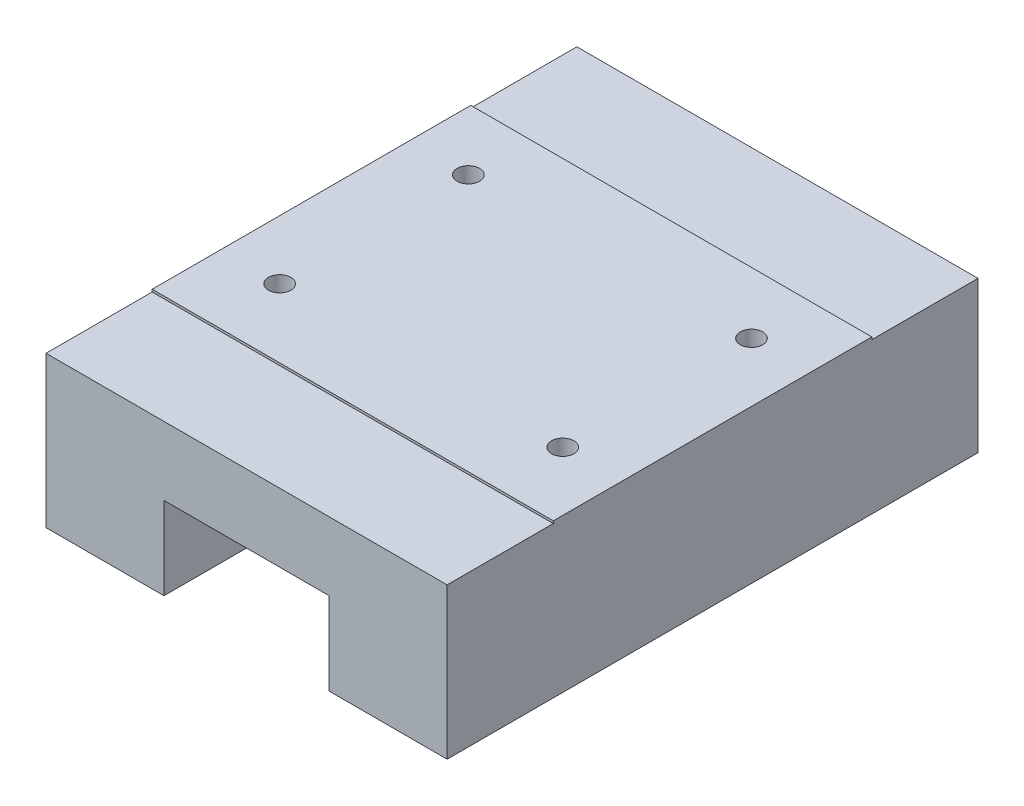
from build123d import *

# Parameters (mm, degrees)
SKETCH1_W                    = 17
SKETCH1_H                    = 6.5
BOSS_EXTRUDE1_DEPTH          = 13.5
BOSS_EXTRUDE2_DEPTH          = 4.5
BOSS_EXTRUDE2_DEPTH_BACK     = 18
SKETCH4_W                    = 17
SKETCH4_H                    = 6.4
M1_2X0_25_TAPPED_HOLE1_D     = 0.95
M1_2X0_25_TAPPED_HOLE1_DEPTH = 3.65
M1_2X0_25_TAPPED_HOLE1_TIP   = 0.285408794
SKETCH5_W                    = 7
SKETCH5_H                    = 3.5
CUT_EXTRUDE1_DEPTH           = 29.939592257


with BuildPart() as part:
    # Sketch1 → Boss-Extrude1 (new body)
    with BuildSketch(Plane.XY):
        with Locations((8.5, 3.25)):
            Rectangle(SKETCH1_W, SKETCH1_H)
    extrude(amount=BOSS_EXTRUDE1_DEPTH)

    # Sketch4 → Boss-Extrude2 (add, two sides: drawn at the far end of the back side and taken through both)
    with BuildSketch(Plane.XY.offset(13.5).offset(-BOSS_EXTRUDE2_DEPTH_BACK)):
        with Locations((8.5, 3.2)):
            Rectangle(SKETCH4_W, SKETCH4_H)
    extrude(amount=BOSS_EXTRUDE2_DEPTH + BOSS_EXTRUDE2_DEPTH_BACK)

    # M1.2x0.25 Tapped Hole1
    with Locations(Plane(origin=(0, 6.5, 0), x_dir=(1, 0, 0), z_dir=(0, 1, 0))):
        with Locations((2.5, -10.6), (14.5, -10.6), (14.5, -2.6), (2.5, -2.6)):
            Hole(M1_2X0_25_TAPPED_HOLE1_D / 2, depth=M1_2X0_25_TAPPED_HOLE1_DEPTH)
            with Locations((0, 0, -(M1_2X0_25_TAPPED_HOLE1_DEPTH + M1_2X0_25_TAPPED_HOLE1_TIP / 2))):  # 118° drill point
                Cone(0, M1_2X0_25_TAPPED_HOLE1_D / 2, M1_2X0_25_TAPPED_HOLE1_TIP, mode=Mode.SUBTRACT)

    # Sketch5 → Cut-Extrude1 (cut, through all)
    with BuildSketch(Plane.XY.offset(18)):
        with Locations((8.5, 1.75)):
            Rectangle(SKETCH5_W, SKETCH5_H)
    extrude(amount=-CUT_EXTRUDE1_DEPTH, mode=Mode.SUBTRACT)


solid = part.part
